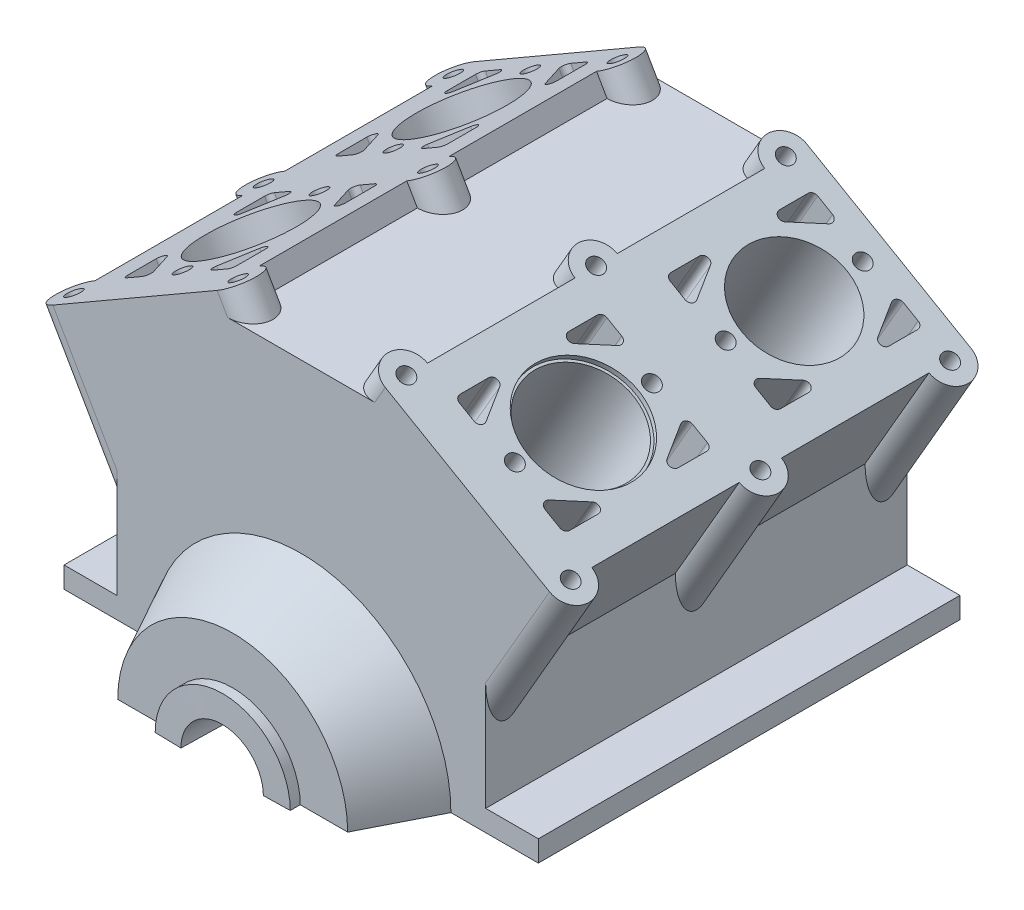
from build123d import *

# Parameters (mm, degrees)
BOSS_EXTRUDE1_DEPTH     = 400
CUT_EXTRUDE5_DEPTH      = 360
HEAD_BOLT_HOLDER_REACH  = 626.031
SKETCH4_R               = 20
LPATTERN4_COUNT         = 3
LPATTERN4_PITCH         = 180
MIRROR3_2_OUTLINE_W     = 12.5
MIRROR3_2_OUTLINE_H     = 31.586316048
MIRROR3_START           = 283
MIRROR3_3_DEPTH         = 32.470053838
MIRROR3_4_OUTLINE_R     = 7.5
MIRROR3_4_DEPTH         = 33
SKETCH11_R              = 50
CUT_EXTRUDE6_DEPTH      = 636.092504118
SKETCH11_3_R            = 7.5
CUT_EXTRUDE7_DEPTH      = 115
SKETCH11_4_R            = 52.5
SKETCH11_4_R_2          = 50
CUT_EXTRUDE8_DEPTH      = 5
SKETCH12_R              = 27.5
SKETCH12_R_2            = 20
BOSS_EXTRUDE2_DEPTH     = 20
LPATTERN6_COUNT         = 2
LPATTERN6_PITCH         = 200
MIRROR6_COPY_1_SKETCH_R = 50
MIRROR6_COPY_1_DEPTH    = 636.092504118
MIRROR6_COPY_2_SKETCH_R = 7.5
MIRROR6_COPY_2_DEPTH    = 115
REVOLVE2_ANGLE          = 180


with BuildPart() as part:
    # Sketch1 → Boss-Extrude1 (new body)
    with BuildSketch(Plane.XY):
        with BuildLine():
            Line((37.5, 0), (225, 0))
            Line((225, 0), (225, 20))
            Line((225, 20), (175, 20))
            Line((175, 20), (175, 123.108891325))
            Line((175, 123.108891325), (235.67731326, 228.205080757))
            Line((235.67731326, 228.205080757), (79.792740578, 318.205080757))
            Line((79.792740578, 318.205080757), (69.792740578, 300.884572681))
            Line((69.792740578, 300.884572681), (-69.792740578, 300.884572681))
            Line((-69.792740578, 300.884572681), (-79.792740578, 318.205080757))
            Line((-79.792740578, 318.205080757), (-235.67731326, 228.205080757))
            Line((-235.67731326, 228.205080757), (-175, 123.108891325))
            Line((-175, 123.108891325), (-175, 20))
            Line((-175, 20), (-225, 20))
            Line((-225, 20), (-225, 0))
            Line((-225, 0), (-37.5, 0))
            ThreePointArc((-37.5, 0), (0, 37.5), (37.5, 0))
        make_face()
    extrude(amount=BOSS_EXTRUDE1_DEPTH)

    # Sketch2 → Cut-Extrude5 (cut)
    with BuildSketch(Plane.XY.offset(380)):
        with BuildLine():
            Line((-155, 0), (155, 0))
            ThreePointArc((155, 0), (0, 155), (-155, 0))
        make_face()
    extrude(amount=-CUT_EXTRUDE5_DEPTH, mode=Mode.SUBTRACT)

    # Head Bolt Holder: up to this plane
    head_bolt_holder_end = Plane(origin=(175, 20, 400), z_dir=(-1, 0, 0))
    # Sketch4 → Head Bolt Holder (add, up to the surface)
    with BuildSketch(Plane(origin=(157.735026919, 273.205080757, 0), x_dir=(0.8660254037844397, -0.49999999999999806, 0), z_dir=(0.49999999999999806, 0.8660254037844397, 0)), mode=Mode.PRIVATE) as head_bolt_holder_sk1:
        with Locations((90, -380)):
            Circle(SKETCH4_R)
    head_bolt_holder_tool1 = split(extrude(head_bolt_holder_sk1.sketch, amount=-HEAD_BOLT_HOLDER_REACH, mode=Mode.PRIVATE), bisect_by=head_bolt_holder_end, keep=Keep.BOTH, mode=Mode.PRIVATE)
    head_bolt_holder = head_bolt_holder_tool1.solids().sort_by_distance((235.677313, 228.205081, 380))[0]
    add(head_bolt_holder)

    # Sketch8 → Ø15.0 (15) Diameter Hole1 (revolve, cut)
    with BuildSketch(Plane(origin=(235.67731326, 228.205080757, 380), x_dir=(-0.8660254037844397, 0.49999999999999817, 0), z_dir=(0, 0, 1))):
        Polygon((0, 0), (0, 119.506454643), (7.5, 115), (7.5, 0), align=None)
    f_15_0_15_diameter_hole1 = revolve(axis=Axis((238.85231326, 233.704342071, 380), (-0.49999999999999806, -0.8660254037844398, 0)), mode=Mode.SUBTRACT)

    # LPattern4: Head Bolt Holder, Ø15.0 (15) Diameter Hole1 ×3
    with Locations(*[(0, 0, -i * LPATTERN4_PITCH) for i in range(1, LPATTERN4_COUNT)]):
        add(head_bolt_holder)
        add(f_15_0_15_diameter_hole1, mode=Mode.SUBTRACT)

    # Mirror3: read off the stored shape, not the designer's step
    # Mirror3 outline → Mirror3 (revolve, cut)
    with BuildSketch(Plane(origin=(-77.942286341, 45, 200), x_dir=(0.8660254037844362, -0.5000000000000042, 0), z_dir=(0, 0, 1))):
        Polygon((0, 315.470053838), (0, 195.963599195), (7.5, 200.470053838), (7.5, 315.470053838), align=None)
    revolve(axis=Axis((-77.942286341, 45, 200), (0.5000000000000042, 0.8660254037844362, 0)), mode=Mode.SUBTRACT)

    # Mirror3 2 outline → Mirror3 2 (revolve)
    with BuildSketch(Plane(origin=(-77.942286341, 45, 200), x_dir=(0.8660254037844362, -0.5000000000000042, 0), z_dir=(0, 0, 1))):
        with Locations((13.75, 299.676895814)):
            Rectangle(MIRROR3_2_OUTLINE_W, MIRROR3_2_OUTLINE_H)
    revolve(axis=Axis((-77.942286341, 45, 200), (0.5000000000000042, 0.8660254037844362, 0)))

    # Mirror3 3 outline → Mirror3 3 (add)
    with BuildSketch(Plane(origin=(0, 0, 0), x_dir=(0.8660254037844362, -0.5000000000000042, 0), z_dir=(0.5000000000000042, 0.8660254037844363, 0)).offset(MIRROR3_START)):
        with BuildLine():
            Line((-90, -372.5), (-90, -360))
            ThreePointArc((-90, -360), (-110, -380), (-90, -400))
            Line((-90, -400), (-90, -387.5))
            ThreePointArc((-90, -387.5), (-97.5, -380), (-90, -372.5))
        make_face()
        with BuildLine():
            Line((-90, -12.5), (-90, 0))
            ThreePointArc((-90, 0), (-110, -20), (-90, -40))
            Line((-90, -40), (-90, -27.5))
            ThreePointArc((-90, -27.5), (-97.5, -20), (-90, -12.5))
        make_face()
    extrude(amount=MIRROR3_3_DEPTH)

    # Mirror3 4 outline → Mirror3 4 (cut)
    with BuildSketch(Plane(origin=(0, 0, 0), x_dir=(0.8660254037844362, -0.5000000000000042, 0), z_dir=(0.5000000000000042, 0.8660254037844363, 0)).offset(MIRROR3_START)):
        with Locations((-90, -380)):
            Circle(MIRROR3_4_OUTLINE_R)
        with Locations((-90, -20)):
            Circle(MIRROR3_4_OUTLINE_R)
    extrude(amount=MIRROR3_4_DEPTH, mode=Mode.SUBTRACT)

    # Mirror3 5 outline → Mirror3 5 (revolve, cut)
    with BuildSketch(Plane(origin=(-77.942286341, 45, 380), x_dir=(0.8660254037844362, -0.5000000000000042, 0), z_dir=(0, 0, 1))):
        Polygon((0, 315.470053838), (0, 195.963599195), (7.5, 200.470053838), (7.5, 315.470053838), align=None)
    revolve(axis=Axis((-77.942286341, 45, 380), (0.5000000000000042, 0.8660254037844362, 0)), mode=Mode.SUBTRACT)

    # Mirror3 6 outline → Mirror3 6 (revolve, cut)
    with BuildSketch(Plane(origin=(-77.942286341, 45, 20), x_dir=(0.8660254037844362, -0.5000000000000042, 0), z_dir=(0, 0, 1))):
        Polygon((0, 315.470053838), (0, 195.963599195), (7.5, 200.470053838), (7.5, 315.470053838), align=None)
    revolve(axis=Axis((-77.942286341, 45, 20), (0.5000000000000042, 0.8660254037844362, 0)), mode=Mode.SUBTRACT)

    # Mirror4: read off the stored shape, not the designer's step
    # Mirror4
    split(bisect_by=Plane(origin=(0, 0, 0), x_dir=(0, 0, 1), z_dir=(1, 0, 0)), keep=Keep.TOP)

    # Mirror4 2: part across plane


with BuildPart() as part_1:
    add(part.part)
    add(part.part.mirror(Plane(origin=(0, 0, 0), x_dir=(0, 0, 1), z_dir=(1, 0, 0))))

    # Sketch11 → Cut-Extrude6 (cut, through all)
    with BuildSketch(Plane(origin=(157.735026919, 273.205080757, 0), x_dir=(0.8660254037844397, -0.4999999999999982, 0), z_dir=(0.4999999999999983, 0.8660254037844398, 0))):
        with Locations(Location((0, -290, 0), (0, 0, 180))):
            Circle(SKETCH11_R)
    cut_extrude6 = extrude(amount=-CUT_EXTRUDE6_DEPTH, mode=Mode.SUBTRACT)

    # Sketch11<3> → Cut-Extrude7 (cut)
    with BuildSketch(Plane(origin=(157.735026919, 273.205080757, 0), x_dir=(0.8660254037844397, -0.4999999999999982, 0), z_dir=(0.4999999999999983, 0.8660254037844398, 0))):
        with BuildLine():
            ThreePointArc((-60, -225), (-58.535533906, -221.464466094), (-55, -220))
            Line((-55, -220), (-38.830951895, -220))
            ThreePointArc((-38.830951895, -220), (-34.479952361, -222.536505925), (-34.543487266, -227.572478777))
            Line((-34.543487266, -227.572478777), (-50.712535371, -254.520892286))
            ThreePointArc((-50.712535371, -254.520892286), (-56.334667909, -256.76698815), (-60, -251.948413509))
            Line((-60, -251.948413509), (-60, -225))
        make_face()
        with BuildLine():
            Line((60, -251.948413509), (60, -225))
            ThreePointArc((60, -225), (58.535533906, -221.464466094), (55, -220))
            Line((55, -220), (38.830951895, -220))
            ThreePointArc((38.830951895, -220), (34.479952361, -222.536505925), (34.543487266, -227.572478777))
            Line((34.543487266, -227.572478777), (50.712535371, -254.520892286))
            ThreePointArc((50.712535371, -254.520892286), (56.334667909, -256.76698815), (60, -251.948413509))
        make_face()
        with BuildLine():
            ThreePointArc((60, -355), (58.535533906, -358.535533906), (55, -360))
            Line((55, -360), (38.830951895, -360))
            ThreePointArc((38.830951895, -360), (34.479952361, -357.463494075), (34.543487266, -352.427521223))
            Line((34.543487266, -352.427521223), (50.712535371, -325.479107714))
            ThreePointArc((50.712535371, -325.479107714), (56.334667909, -323.23301185), (60, -328.051586491))
            Line((60, -328.051586491), (60, -355))
        make_face()
        with BuildLine():
            Line((-60, -328.051586491), (-60, -355))
            ThreePointArc((-60, -355), (-58.535533906, -358.535533906), (-55, -360))
            Line((-55, -360), (-38.830951895, -360))
            ThreePointArc((-38.830951895, -360), (-34.479952361, -357.463494075), (-34.543487266, -352.427521223))
            Line((-34.543487266, -352.427521223), (-50.712535371, -325.479107714))
            ThreePointArc((-50.712535371, -325.479107714), (-56.334667909, -323.23301185), (-60, -328.051586491))
        make_face()
        with Locations((0, -225)):
            Circle(SKETCH11_3_R)
        with Locations(Location((0, -355, 0), (0, 0, 180))):
            Circle(SKETCH11_3_R)
    cut_extrude7 = extrude(amount=-CUT_EXTRUDE7_DEPTH, mode=Mode.SUBTRACT)

    # Sketch11<4> → Cut-Extrude8 (cut)
    with BuildSketch(Plane(origin=(157.735026919, 273.205080757, 0), x_dir=(0.8660254037844397, -0.4999999999999982, 0), z_dir=(0.4999999999999983, 0.8660254037844398, 0))):
        with Locations(Location((0, -290, 0), (0, 0, 180))):
            Circle(SKETCH11_4_R)
        with Locations(Location((0, -290, 0), (0, 0, 180))):
            Circle(SKETCH11_4_R_2, mode=Mode.SUBTRACT)
    extrude(amount=-CUT_EXTRUDE8_DEPTH, mode=Mode.SUBTRACT)

    # Sketch12 → Boss-Extrude2 (add)
    with BuildSketch(Plane.XY):
        with Locations((0, 250.884572681)):
            Circle(SKETCH12_R)
        with Locations((0, 250.884572681)):
            Circle(SKETCH12_R_2, mode=Mode.SUBTRACT)
    extrude(amount=-BOSS_EXTRUDE2_DEPTH)

    # LPattern6: Cut-Extrude6, Cut-Extrude7 ×2
    with Locations(*[(0, 0, -i * LPATTERN6_PITCH) for i in range(1, LPATTERN6_COUNT)]):
        add(cut_extrude6, mode=Mode.SUBTRACT)
        add(cut_extrude7, mode=Mode.SUBTRACT)

    # Mirror6: Cut-Extrude6, Cut-Extrude7 across plane
    add(cut_extrude6.mirror(Plane(origin=(0, 0, 0), x_dir=(0, 0, 1), z_dir=(1, 0, 0))), mode=Mode.SUBTRACT)
    add(cut_extrude7.mirror(Plane(origin=(0, 0, 0), x_dir=(0, 0, 1), z_dir=(1, 0, 0))), mode=Mode.SUBTRACT)

    # Mirror6 copy 1 sketch → Mirror6 copy 1 (cut, through all)
    with BuildSketch(Plane(origin=(-157.735026919, 273.205080757, -200), x_dir=(-0.8660254037844397, -0.4999999999999982, 0), z_dir=(-0.4999999999999983, 0.8660254037844398, 0))):
        with Locations((0, 290)):
            Circle(MIRROR6_COPY_1_SKETCH_R)
    extrude(amount=-MIRROR6_COPY_1_DEPTH, mode=Mode.SUBTRACT)

    # Mirror6 copy 2 sketch → Mirror6 copy 2 (cut)
    with BuildSketch(Plane(origin=(-157.735026919, 273.205080757, -200), x_dir=(-0.8660254037844397, -0.4999999999999982, 0), z_dir=(-0.4999999999999983, 0.8660254037844398, 0))):
        with BuildLine():
            ThreePointArc((-60, 225), (-58.535533906, 221.464466094), (-55, 220))
            Line((-55, 220), (-38.830951895, 220))
            ThreePointArc((-38.830951895, 220), (-34.479952361, 222.536505925), (-34.543487266, 227.572478777))
            Line((-34.543487266, 227.572478777), (-50.712535371, 254.520892286))
            ThreePointArc((-50.712535371, 254.520892286), (-56.334667909, 256.76698815), (-60, 251.948413509))
            Line((-60, 251.948413509), (-60, 225))
        make_face()
        with BuildLine():
            Line((60, 251.948413509), (60, 225))
            ThreePointArc((60, 225), (58.535533906, 221.464466094), (55, 220))
            Line((55, 220), (38.830951895, 220))
            ThreePointArc((38.830951895, 220), (34.479952361, 222.536505925), (34.543487266, 227.572478777))
            Line((34.543487266, 227.572478777), (50.712535371, 254.520892286))
            ThreePointArc((50.712535371, 254.520892286), (56.334667909, 256.76698815), (60, 251.948413509))
        make_face()
        with BuildLine():
            ThreePointArc((60, 355), (58.535533906, 358.535533906), (55, 360))
            Line((55, 360), (38.830951895, 360))
            ThreePointArc((38.830951895, 360), (34.479952361, 357.463494075), (34.543487266, 352.427521223))
            Line((34.543487266, 352.427521223), (50.712535371, 325.479107714))
            ThreePointArc((50.712535371, 325.479107714), (56.334667909, 323.23301185), (60, 328.051586491))
            Line((60, 328.051586491), (60, 355))
        make_face()
        with BuildLine():
            Line((-60, 328.051586491), (-60, 355))
            ThreePointArc((-60, 355), (-58.535533906, 358.535533906), (-55, 360))
            Line((-55, 360), (-38.830951895, 360))
            ThreePointArc((-38.830951895, 360), (-34.479952361, 357.463494075), (-34.543487266, 352.427521223))
            Line((-34.543487266, 352.427521223), (-50.712535371, 325.479107714))
            ThreePointArc((-50.712535371, 325.479107714), (-56.334667909, 323.23301185), (-60, 328.051586491))
        make_face()
        with Locations((0, 225)):
            Circle(MIRROR6_COPY_2_SKETCH_R)
        with Locations((0, 355)):
            Circle(MIRROR6_COPY_2_SKETCH_R)
    extrude(amount=-MIRROR6_COPY_2_DEPTH, mode=Mode.SUBTRACT)

    # Sketch13 → Revolve2 (revolve)
    with BuildSketch(Plane(origin=(0, 0, 0), x_dir=(1, 0, 0), z_dir=(0, 1, 0))):
        Polygon((37.5, -400), (39.086141667, -475), (64.086141667, -474.471286111), (64.086141667, -465), (109.086141667, -465), (142.030440873, -400), align=None)
        Polygon((38.357804914, 75), (38.357804914, 0), (142.030440873, 0), (108.357804914, 65), (63.357804914, 65), (63.357804914, 75), align=None)
    revolve(axis=Axis((0, 0, 420), (0, 0, 1)), revolution_arc=REVOLVE2_ANGLE)


solid = part_1.part
